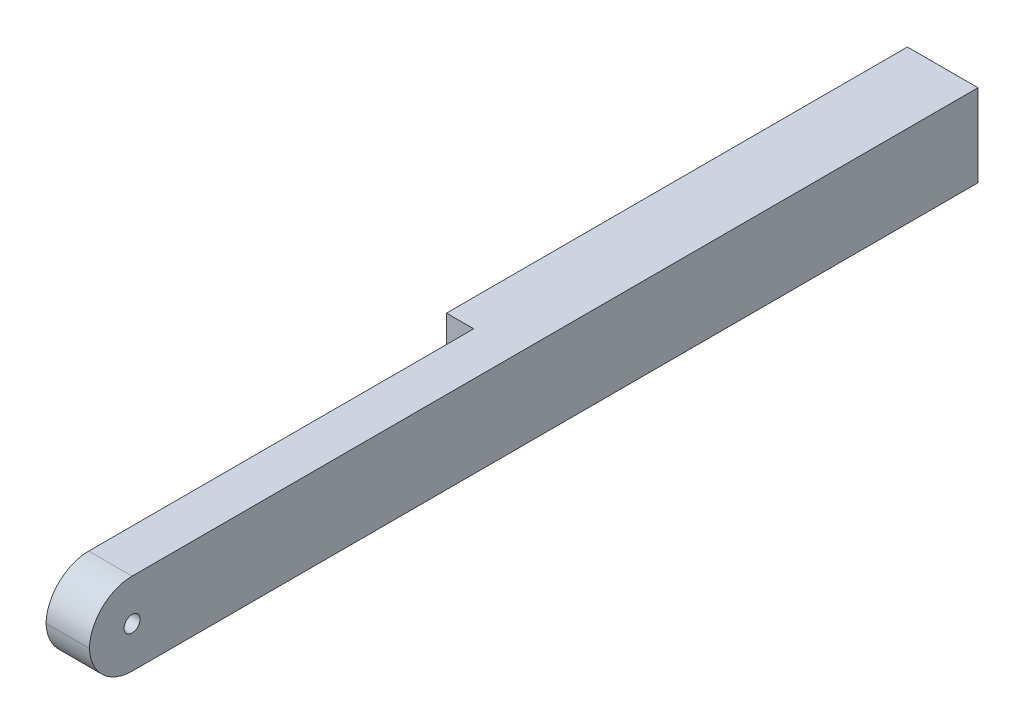
from build123d import *

# Parameters (mm, degrees)
SKIZZE1_W                       = 66
SKIZZE1_H                       = 77
AUFSATZ_LINEAR_AUSTRAGEN1_DEPTH = 831
SKIZZE2_W                       = 25
SKIZZE2_H                       = 29
SCHNITT_LINEAR_AUSTRAGEN1_DEPTH = 831
AUFSATZ_LINEAR_AUSTRAGEN3_DEPTH = 25
SKIZZE6_W                       = 25.447889481
SKIZZE6_H                       = 77
SCHNITT_LINEAR_AUSTRAGEN2_DEPTH = 400
SKIZZE7_R                       = 7.5
SCHNITT_LINEAR_AUSTRAGEN3_DEPTH = 40.552110519
VERRUNDUNG1_R                   = 40


with BuildPart() as part:
    # Skizze1 → Aufsatz-Linear austragen1 (new body)
    with BuildSketch(Plane.XY):
        Rectangle(SKIZZE1_W, SKIZZE1_H)
    extrude(amount=AUFSATZ_LINEAR_AUSTRAGEN1_DEPTH)

    # Skizze2 → Schnitt-Linear austragen1 (cut)
    with BuildSketch(Plane(origin=(0, 0, 0), x_dir=(-1, 0, 0), z_dir=(0, 0, -1))):
        with Locations((20.5, -6)):
            Rectangle(SKIZZE2_W, SKIZZE2_H)
    extrude(amount=-SCHNITT_LINEAR_AUSTRAGEN1_DEPTH, mode=Mode.SUBTRACT)

    # Skizze3 → Aufsatz-Linear austragen3 (add)
    with BuildSketch(Plane.ZY.offset(8)):
        Polygon((18.366966389, -20.5), (10, -20.5), (13.005947615, -12.215094727), (15.361018774, -12.215094727), align=None)
        Polygon((0, -20.5), (3.005947615, -12.215094727), (5.361018774, -12.215094727), (8.366966389, -20.5), align=None)
        Polygon((28.366966389, -20.5), (20, -20.5), (23.005947615, -12.215094727), (25.361018774, -12.215094727), align=None)
        Polygon((38.366966389, -20.5), (30, -20.5), (33.005947615, -12.215094727), (35.361018774, -12.215094727), align=None)
        Polygon((48.366966389, -20.5), (40, -20.5), (43.005947615, -12.215094727), (45.361018774, -12.215094727), align=None)
        Polygon((58.366966389, -20.5), (50, -20.5), (53.005947615, -12.215094727), (55.361018774, -12.215094727), align=None)
        Polygon((68.366966389, -20.5), (60, -20.5), (63.005947615, -12.215094727), (65.361018774, -12.215094727), align=None)
        Polygon((78.366966389, -20.5), (70, -20.5), (73.005947615, -12.215094727), (75.361018774, -12.215094727), align=None)
        Polygon((88.366966389, -20.5), (80, -20.5), (83.005947615, -12.215094727), (85.361018774, -12.215094727), align=None)
        Polygon((98.366966389, -20.5), (90, -20.5), (93.005947615, -12.215094727), (95.361018774, -12.215094727), align=None)
        Polygon((108.366966389, -20.5), (100, -20.5), (103.005947615, -12.215094727), (105.361018774, -12.215094727), align=None)
        Polygon((118.366966389, -20.5), (110, -20.5), (113.005947615, -12.215094727), (115.361018774, -12.215094727), align=None)
        Polygon((128.366966389, -20.5), (120, -20.5), (123.005947615, -12.215094727), (125.361018774, -12.215094727), align=None)
        Polygon((138.366966389, -20.5), (130, -20.5), (133.005947615, -12.215094727), (135.361018774, -12.215094727), align=None)
        Polygon((148.366966389, -20.5), (140, -20.5), (143.005947615, -12.215094727), (145.361018774, -12.215094727), align=None)
        Polygon((158.366966389, -20.5), (150, -20.5), (153.005947615, -12.215094727), (155.361018774, -12.215094727), align=None)
        Polygon((168.366966389, -20.5), (160, -20.5), (163.005947615, -12.215094727), (165.361018774, -12.215094727), align=None)
        Polygon((178.366966389, -20.5), (170, -20.5), (173.005947615, -12.215094727), (175.361018774, -12.215094727), align=None)
        Polygon((188.366966389, -20.5), (180, -20.5), (183.005947615, -12.215094727), (185.361018774, -12.215094727), align=None)
        Polygon((198.366966389, -20.5), (190, -20.5), (193.005947615, -12.215094727), (195.361018774, -12.215094727), align=None)
        Polygon((208.366966389, -20.5), (200, -20.5), (203.005947615, -12.215094727), (205.361018774, -12.215094727), align=None)
        Polygon((218.366966389, -20.5), (210, -20.5), (213.005947615, -12.215094727), (215.361018774, -12.215094727), align=None)
        Polygon((228.366966389, -20.5), (220, -20.5), (223.005947615, -12.215094727), (225.361018774, -12.215094727), align=None)
        Polygon((238.366966389, -20.5), (230, -20.5), (233.005947615, -12.215094727), (235.361018774, -12.215094727), align=None)
        Polygon((248.366966389, -20.5), (240, -20.5), (243.005947615, -12.215094727), (245.361018774, -12.215094727), align=None)
        Polygon((258.366966389, -20.5), (250, -20.5), (253.005947615, -12.215094727), (255.361018774, -12.215094727), align=None)
        Polygon((268.366966389, -20.5), (260, -20.5), (263.005947615, -12.215094727), (265.361018774, -12.215094727), align=None)
        Polygon((278.366966389, -20.5), (270, -20.5), (273.005947615, -12.215094727), (275.361018774, -12.215094727), align=None)
        Polygon((288.366966389, -20.5), (280, -20.5), (283.005947615, -12.215094727), (285.361018774, -12.215094727), align=None)
        Polygon((298.366966389, -20.5), (290, -20.5), (293.005947615, -12.215094727), (295.361018774, -12.215094727), align=None)
        Polygon((308.366966389, -20.5), (300, -20.5), (303.005947615, -12.215094727), (305.361018774, -12.215094727), align=None)
        Polygon((318.366966389, -20.5), (310, -20.5), (313.005947615, -12.215094727), (315.361018774, -12.215094727), align=None)
        Polygon((328.366966389, -20.5), (320, -20.5), (323.005947615, -12.215094727), (325.361018774, -12.215094727), align=None)
        Polygon((338.366966389, -20.5), (330, -20.5), (333.005947615, -12.215094727), (335.361018774, -12.215094727), align=None)
        Polygon((348.366966389, -20.5), (340, -20.5), (343.005947615, -12.215094727), (345.361018774, -12.215094727), align=None)
        Polygon((358.366966389, -20.5), (350, -20.5), (353.005947615, -12.215094727), (355.361018774, -12.215094727), align=None)
        Polygon((368.366966389, -20.5), (360, -20.5), (363.005947615, -12.215094727), (365.361018774, -12.215094727), align=None)
        Polygon((378.366966389, -20.5), (370, -20.5), (373.005947615, -12.215094727), (375.361018774, -12.215094727), align=None)
        Polygon((388.366966389, -20.5), (380, -20.5), (383.005947615, -12.215094727), (385.361018774, -12.215094727), align=None)
        Polygon((398.366966389, -20.5), (390, -20.5), (393.005947615, -12.215094727), (395.361018774, -12.215094727), align=None)
        Polygon((408.366966389, -20.5), (400, -20.5), (403.005947615, -12.215094727), (405.361018774, -12.215094727), align=None)
        Polygon((418.366966389, -20.5), (410, -20.5), (413.005947615, -12.215094727), (415.361018774, -12.215094727), align=None)
        Polygon((428.366966389, -20.5), (420, -20.5), (423.005947615, -12.215094727), (425.361018774, -12.215094727), align=None)
    extrude(amount=AUFSATZ_LINEAR_AUSTRAGEN3_DEPTH)

    # Skizze6 → Schnitt-Linear austragen2 (cut)
    with BuildSketch(Plane.XY.offset(831)):
        with Locations((-20.27605526, 0)):
            Rectangle(SKIZZE6_W, SKIZZE6_H)
    extrude(amount=-SCHNITT_LINEAR_AUSTRAGEN2_DEPTH, mode=Mode.SUBTRACT)

    # Skizze7 → Schnitt-Linear austragen3 (cut)
    with BuildSketch(Plane.ZY.offset(7.552110519)):
        with Locations((791, 0)):
            Circle(SKIZZE7_R)
    extrude(amount=-SCHNITT_LINEAR_AUSTRAGEN3_DEPTH, mode=Mode.SUBTRACT)

    # Verrundung1
    # the kernel refuses this fillet: 40 mm, written as the material it takes off along each edge
    with BuildSketch(Plane(origin=(-107.552110519, -38.5, 831), x_dir=(0, 0, -1), z_dir=(1, 0, 0))) as verrundung1_piece_1:
        with BuildLine():
            CenterArc((VERRUNDUNG1_R, VERRUNDUNG1_R), VERRUNDUNG1_R, 180, 90)
            Line((0, VERRUNDUNG1_R), (0, 0))
            Line((0, 0), (VERRUNDUNG1_R, 0))
        make_face()
    extrude(amount=240.552110519, mode=Mode.SUBTRACT)
    with BuildSketch(Plane(origin=(133, 38.5, 831), x_dir=(0, -1, 0), z_dir=(-1, 0, 0))) as verrundung1_piece_2:
        with BuildLine():
            CenterArc((VERRUNDUNG1_R, -VERRUNDUNG1_R), VERRUNDUNG1_R, 90, 90)
            Line((0, -VERRUNDUNG1_R), (0, 0))
            Line((0, 0), (VERRUNDUNG1_R, 0))
        make_face()
    extrude(amount=240.552110519, mode=Mode.SUBTRACT)


solid = part.part
